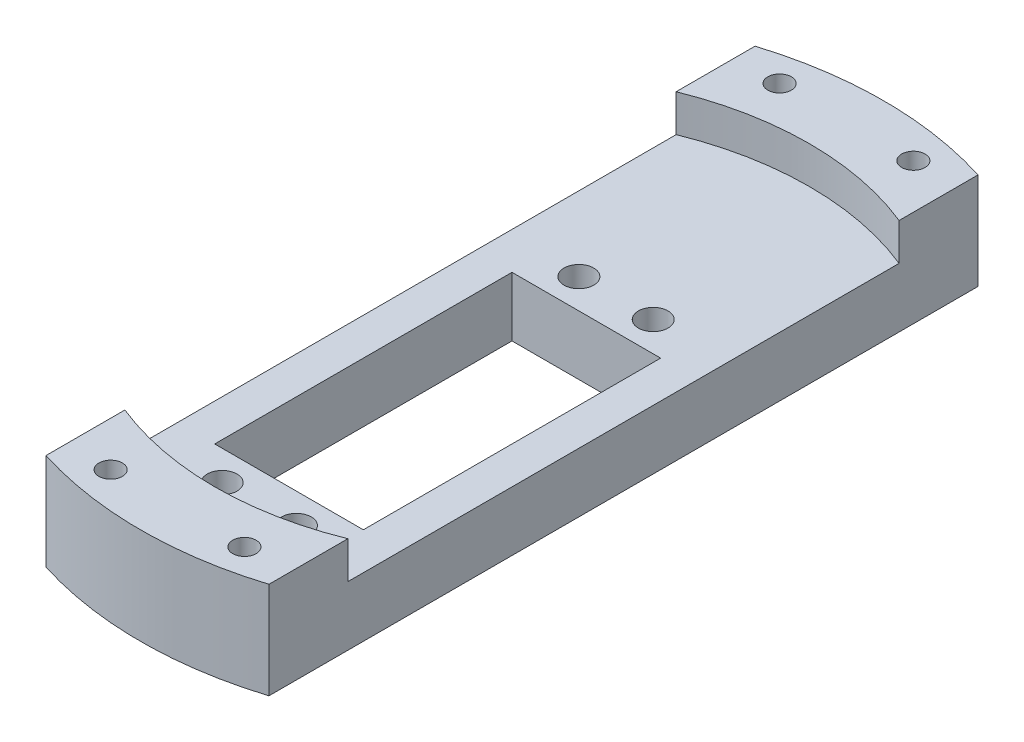
from build123d import *

# Parameters (mm, degrees)
SKETCH_1_R                  = 2
SKETCH_1_W                  = 20
SKETCH_1_H                  = 40
EXTRUDE_1_DEPTH             = 8
EXTRUDE_2_DEPTH             = 5
HOLE_WIZARD_M31_D           = 3.15
PATTERN_LINEAR_1_COUNT      = 2
PATTERN_LINEAR_1_PITCH      = 18
PATTERN_LINEAR_1_COUNT_DIR2 = 2
PATTERN_LINEAR_1_PITCH_DIR2 = 90


with BuildPart() as part:
    # Эскиз1 → Бобышка-Вытянуть1 (new body)
    with BuildSketch(Plane(origin=(0, 0, 0), x_dir=(1, 0, 0), z_dir=(0, 1, 0))):
        with BuildLine():
            Line((-15, -47.696960071), (-15, 47.696960071))
            ThreePointArc((-15, 47.696960071), (0, 50), (15, 47.696960071))
            Line((15, 47.696960071), (15, -47.696960071))
            ThreePointArc((15, -47.696960071), (0, -50), (-15, -47.696960071))
        make_face()
        with Locations((-5, -34)):
            Circle(SKETCH_1_R, mode=Mode.SUBTRACT)
        with Locations((5, -34)):
            Circle(SKETCH_1_R, mode=Mode.SUBTRACT)
        with Locations((5, 14)):
            Circle(SKETCH_1_R, mode=Mode.SUBTRACT)
        with Locations((-5, 14)):
            Circle(SKETCH_1_R, mode=Mode.SUBTRACT)
        with Locations((0, -10)):
            Rectangle(SKETCH_1_W, SKETCH_1_H, mode=Mode.SUBTRACT)
    extrude(amount=EXTRUDE_1_DEPTH)

    # Эскиз2 → Бобышка-Вытянуть2 (add)
    with BuildSketch(Plane(origin=(0, 8, 0), x_dir=(1, 0, 0), z_dir=(0, 1, 0))):
        with BuildLine():
            Line((-15, 37.080992435), (-15, 47.696960071))
            ThreePointArc((-15, 47.696960071), (0, 50), (15, 47.696960071))
            Line((15, 47.696960071), (15, 37.080992435))
            ThreePointArc((15, 37.080992435), (0, 40), (-15, 37.080992435))
        make_face()
        with BuildLine():
            Line((-15, -37.080992435), (-15, -47.696960071))
            ThreePointArc((-15, -47.696960071), (0, -50), (15, -47.696960071))
            Line((15, -47.696960071), (15, -37.080992435))
            ThreePointArc((15, -37.080992435), (0, -40), (-15, -37.080992435))
        make_face()
    extrude(amount=EXTRUDE_2_DEPTH)

    # Сверло под метчик  спиральное M31 (through all)
    with Locations(Plane(origin=(0, 13, 0), x_dir=(1, 0, 0), z_dir=(0, 1, 0))):
        with Locations((-9, -45)):
            hole_wizard_m31 = Hole(HOLE_WIZARD_M31_D / 2)

    # Линейный массив1: Hole Wizard M31 2 × 2
    with Locations(*[(i * PATTERN_LINEAR_1_PITCH, 0, -j * PATTERN_LINEAR_1_PITCH_DIR2) for i in range(PATTERN_LINEAR_1_COUNT) for j in range(PATTERN_LINEAR_1_COUNT_DIR2) if (i, j) != (0, 0)]):
        add(hole_wizard_m31, mode=Mode.SUBTRACT)


solid = part.part
